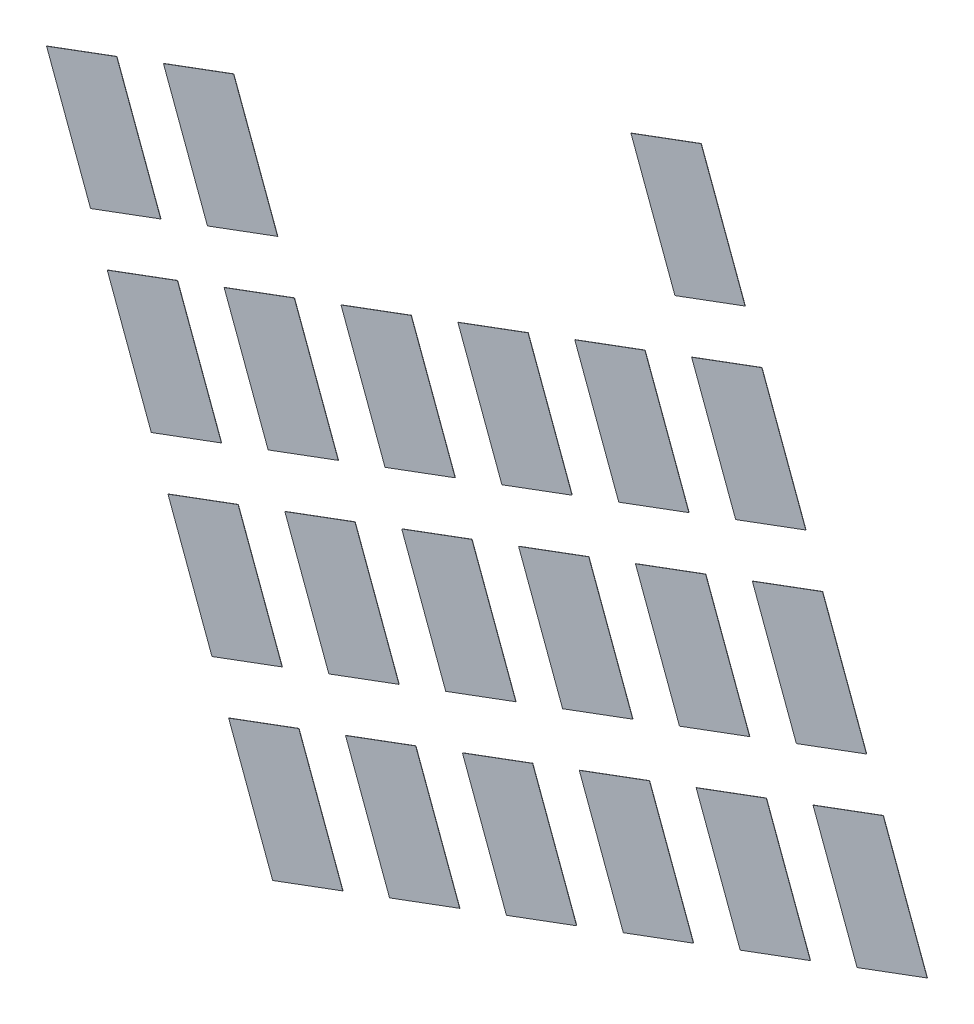
from build123d import *

# Parameters (mm, degrees)
BOSS_EXTRUDE1_DEPTH   = 10
LPATTERN1_START       = 35019.972121918
LPATTERN1_OUTLINE_W   = 5074.876048893
LPATTERN1_OUTLINE_H   = 10
LPATTERN1_DEPTH       = 3000
LPATTERN1_START_2     = 55019.972121918
LPATTERN1_2_OUTLINE_W = 5074.876048893
LPATTERN1_2_OUTLINE_H = 10
LPATTERN1_2_DEPTH     = 3000
LPATTERN1_START_3     = 30019.972121918
LPATTERN1_3_OUTLINE_W = 5074.876048893
LPATTERN1_3_OUTLINE_H = 10
LPATTERN1_3_DEPTH     = 2999.999999999
LPATTERN1_START_4     = 40019.972121918
LPATTERN1_4_OUTLINE_W = 5074.876048893
LPATTERN1_4_OUTLINE_H = 10
LPATTERN1_4_DEPTH     = 3000
LPATTERN1_START_5     = 45019.972121918
LPATTERN1_5_OUTLINE_W = 5074.876048893
LPATTERN1_5_OUTLINE_H = 10
LPATTERN1_5_DEPTH     = 3000
LPATTERN1_START_6     = 50019.972121918
LPATTERN1_6_OUTLINE_W = 5074.876048893
LPATTERN1_6_OUTLINE_H = 10
LPATTERN1_6_DEPTH     = 3000


# Read off the part's stored shape, not the designer's step: LPattern1
with BuildPart() as part:
    # Sketch1 → Boss-Extrude1 (new body)
    with BuildSketch(Plane.XY):
        Polygon((8159.170995645, 64317.913133173), (10971.869650874, 65361.333602048), (12736.946166348, 60603.301255988), (9924.247511118, 59559.880787113), align=None)
    extrude(amount=BOSS_EXTRUDE1_DEPTH)


with BuildPart() as body_2:
    # LPattern1 outline → LPattern1 (new body)
    with BuildSketch(Plane(origin=(0, 0, 0), x_dir=(-0.3478068229585231, 0.937566218409931, 0), z_dir=(0.9375662184099312, 0.34780682295852305, 0)).offset(LPATTERN1_START)):
        with Locations((33927.049225871, 5)):
            Rectangle(LPATTERN1_OUTLINE_W, LPATTERN1_OUTLINE_H)
        with Locations((40927.049225871, 5)):
            Rectangle(LPATTERN1_OUTLINE_W, LPATTERN1_OUTLINE_H)
        with Locations((47927.049225871, 5)):
            Rectangle(LPATTERN1_OUTLINE_W, LPATTERN1_OUTLINE_H)
        with Locations((54927.049225871, 5)):
            Rectangle(LPATTERN1_OUTLINE_W, LPATTERN1_OUTLINE_H)
    extrude(amount=LPATTERN1_DEPTH)


with BuildPart() as body_3:
    # LPattern1 2 outline → LPattern1 2 (new body)
    with BuildSketch(Plane(origin=(0, 0, 0), x_dir=(-0.3478068229585231, 0.937566218409931, 0), z_dir=(0.9375662184099312, 0.34780682295852305, 0)).offset(LPATTERN1_START_2)):
        with Locations((33927.049225871, 5)):
            Rectangle(LPATTERN1_2_OUTLINE_W, LPATTERN1_2_OUTLINE_H)
        with Locations((40927.049225871, 5)):
            Rectangle(LPATTERN1_2_OUTLINE_W, LPATTERN1_2_OUTLINE_H)
        with Locations((47927.049225871, 5)):
            Rectangle(LPATTERN1_2_OUTLINE_W, LPATTERN1_2_OUTLINE_H)
        with Locations((54927.049225871, 5)):
            Rectangle(LPATTERN1_2_OUTLINE_W, LPATTERN1_2_OUTLINE_H)
    extrude(amount=LPATTERN1_2_DEPTH)


with BuildPart() as body_4:
    # LPattern1 3 outline → LPattern1 3 (new body)
    with BuildSketch(Plane(origin=(0, 0, 0), x_dir=(-0.3478068229585231, 0.937566218409931, 0), z_dir=(0.9375662184099312, 0.34780682295852305, 0)).offset(LPATTERN1_START_3)):
        with Locations((33927.049225871, 5)):
            Rectangle(LPATTERN1_3_OUTLINE_W, LPATTERN1_3_OUTLINE_H)
        with Locations((40927.049225871, 5)):
            Rectangle(LPATTERN1_3_OUTLINE_W, LPATTERN1_3_OUTLINE_H)
        with Locations((47927.049225871, 5)):
            Rectangle(LPATTERN1_3_OUTLINE_W, LPATTERN1_3_OUTLINE_H)
    extrude(amount=LPATTERN1_3_DEPTH)


with BuildPart() as body_5:
    # LPattern1 4 outline → LPattern1 4 (new body)
    with BuildSketch(Plane(origin=(0, 0, 0), x_dir=(-0.3478068229585231, 0.937566218409931, 0), z_dir=(0.9375662184099312, 0.34780682295852305, 0)).offset(LPATTERN1_START_4)):
        with Locations((33927.049225871, 5)):
            Rectangle(LPATTERN1_4_OUTLINE_W, LPATTERN1_4_OUTLINE_H)
        with Locations((40927.049225871, 5)):
            Rectangle(LPATTERN1_4_OUTLINE_W, LPATTERN1_4_OUTLINE_H)
        with Locations((47927.049225871, 5)):
            Rectangle(LPATTERN1_4_OUTLINE_W, LPATTERN1_4_OUTLINE_H)
    extrude(amount=LPATTERN1_4_DEPTH)


with BuildPart() as body_6:
    # LPattern1 5 outline → LPattern1 5 (new body)
    with BuildSketch(Plane(origin=(0, 0, 0), x_dir=(-0.3478068229585231, 0.937566218409931, 0), z_dir=(0.9375662184099312, 0.34780682295852305, 0)).offset(LPATTERN1_START_5)):
        with Locations((33927.049225871, 5)):
            Rectangle(LPATTERN1_5_OUTLINE_W, LPATTERN1_5_OUTLINE_H)
        with Locations((40927.049225871, 5)):
            Rectangle(LPATTERN1_5_OUTLINE_W, LPATTERN1_5_OUTLINE_H)
        with Locations((47927.049225871, 5)):
            Rectangle(LPATTERN1_5_OUTLINE_W, LPATTERN1_5_OUTLINE_H)
    extrude(amount=LPATTERN1_5_DEPTH)


with BuildPart() as body_7:
    # LPattern1 6 outline → LPattern1 6 (new body)
    with BuildSketch(Plane(origin=(0, 0, 0), x_dir=(-0.3478068229585231, 0.937566218409931, 0), z_dir=(0.9375662184099312, 0.34780682295852305, 0)).offset(LPATTERN1_START_6)):
        with Locations((33927.049225871, 5)):
            Rectangle(LPATTERN1_6_OUTLINE_W, LPATTERN1_6_OUTLINE_H)
        with Locations((40927.049225871, 5)):
            Rectangle(LPATTERN1_6_OUTLINE_W, LPATTERN1_6_OUTLINE_H)
        with Locations((47927.049225871, 5)):
            Rectangle(LPATTERN1_6_OUTLINE_W, LPATTERN1_6_OUTLINE_H)
    extrude(amount=LPATTERN1_6_DEPTH)


solid = Compound([part.part, body_2.part, body_3.part, body_4.part, body_5.part, body_6.part, body_7.part])
